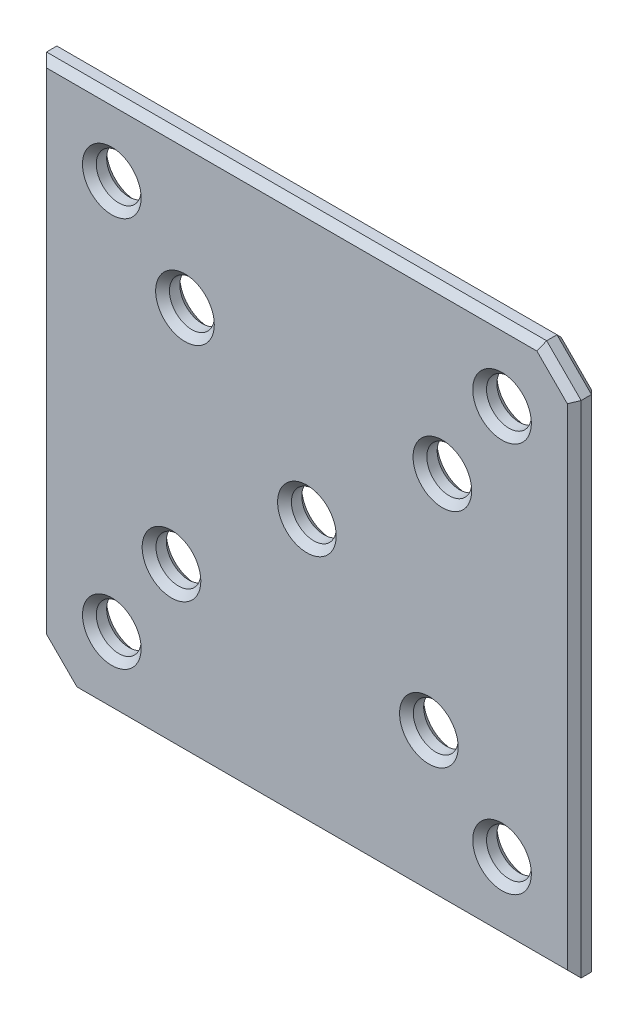
from build123d import *

# Parameters (mm, degrees)
SKETCH_1_R         = 13
EXTRUDE_1180_DEPTH = 14
CHAMFER_1_SIZE     = 4


with BuildPart() as part:
    # 草图1 → Extrude 1180 (new body)
    with BuildSketch(Plane.XY):
        Polygon((135, 155), (155, 135), (155, -155), (-135, -155), (-155, -135), (-155, 155), align=None)
        with Locations((-113.13708499, -113.13708499)):
            Circle(SKETCH_1_R, mode=Mode.SUBTRACT)
        with Locations((-78.524110604, -61.919012055)):
            Circle(SKETCH_1_R, mode=Mode.SUBTRACT)
        with Locations((78.524110604, 61.919012055)):
            Circle(SKETCH_1_R, mode=Mode.SUBTRACT)
        with Locations((113.13708499, 113.13708499)):
            Circle(SKETCH_1_R, mode=Mode.SUBTRACT)
        with Locations((-70.710678119, 70.710678119)):
            Circle(SKETCH_1_R, mode=Mode.SUBTRACT)
        with Locations((-113.13708499, 113.13708499)):
            Circle(SKETCH_1_R, mode=Mode.SUBTRACT)
        with Locations((70.710678119, -70.710678119)):
            Circle(SKETCH_1_R, mode=Mode.SUBTRACT)
        with Locations((113.13708499, -113.13708499)):
            Circle(SKETCH_1_R, mode=Mode.SUBTRACT)
        Circle(SKETCH_1_R, mode=Mode.SUBTRACT)
    extrude(amount=EXTRUDE_1180_DEPTH)

    # 倒角1
    chamfer_1_edges = [part.edges().sort_by_distance(p)[0] for p in [
        (100.13708499, -113.13708499, 0),
        (57.710678119, -70.710678119, 0),
        (-83.710678119, 70.710678119, 0),
        (65.524110604, 61.919012055, 0),
        (-126.13708499, -113.13708499, 0),
        (-145, -145, 0),
        (10, -155, 0),
        (155, -10, 0),
        (145, 145, 0),
        (-10, 155, 0),
        (-155, 10, 0),
        (-91.524110604, -61.919012055, 0),
        (100.13708499, 113.13708499, 0),
        (-126.13708499, 113.13708499, 0),
        (-13, 0, 0),
        (100.13708499, -113.13708499, 14),
        (57.710678119, -70.710678119, 14),
        (-83.710678119, 70.710678119, 14),
        (65.524110604, 61.919012055, 14),
        (-126.13708499, -113.13708499, 14),
        (-10, 155, 14),
        (145, 145, 14),
        (155, -10, 14),
        (10, -155, 14),
        (-145, -145, 14),
        (-155, 10, 14),
        (-91.524110604, -61.919012055, 14),
        (100.13708499, 113.13708499, 14),
        (-126.13708499, 113.13708499, 14),
        (-13, 0, 14),
    ]]
    chamfer(chamfer_1_edges, length=CHAMFER_1_SIZE)


solid = part.part
